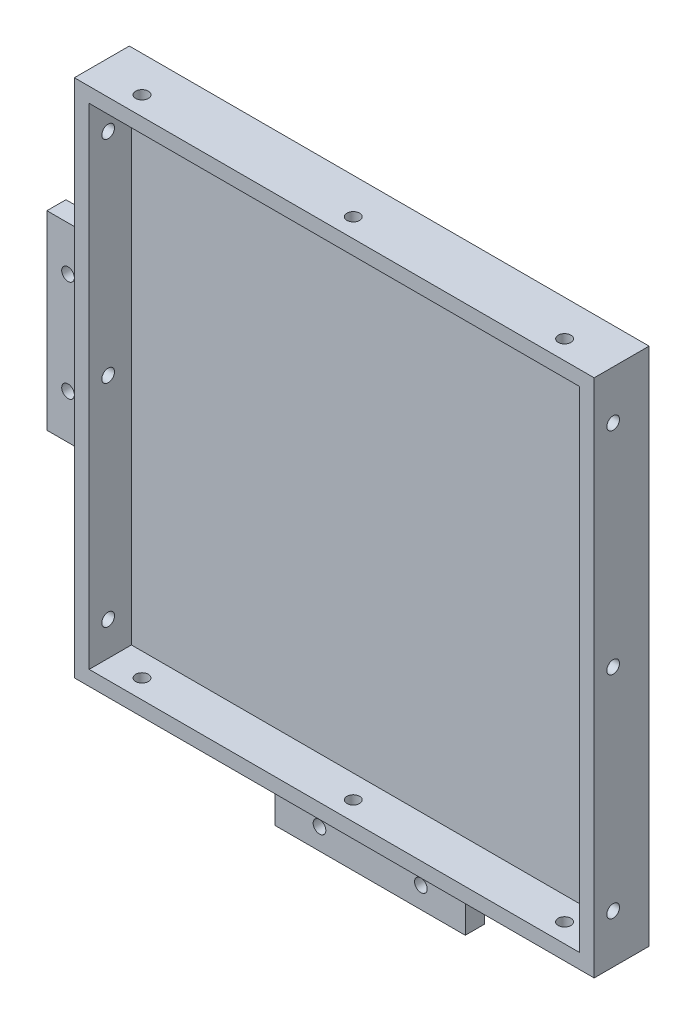
from build123d import *

# Parameters (mm, degrees)
SKETCH_3_W               = 123
SKETCH_3_H               = 123
EXTRUDE_2_DEPTH          = 3
SKETCH_4_W               = 123
SKETCH_4_H               = 123
SKETCH_4_W_2             = 116
SKETCH_4_H_2             = 116
EXTRUDE_3_DEPTH          = 10
SKETCH_7_R               = 1.5
CUT_EXTRUDE_1_DEPTH      = 139.131278138
SKETCH_9_R               = 1.5
CUT_EXTRUDE_2_DEPTH      = 139.131278138
SKETCH_10_W              = 45
SKETCH_10_H              = 15
EXTRUDE_4_DEPTH          = 4.5
SKETCH_11_R              = 1.5
CUT_EXTRUDE_3_DEPTH      = 99.522839992
PATTERN_CIRCULAR_1_COUNT = 2
PATTERN_CIRCULAR_1_ANGLE = 90
FILLET_1_R               = 8
SKETCH_13_R              = 3
CUT_EXTRUDE_4_DEPTH      = 146.431255238
SKETCH_14_R              = 2.049164466
CUT_EXTRUDE_6_DEPTH      = 146.431255238


with BuildPart() as part:
    # 草图3 → 凸台-拉伸2 (new body)
    with BuildSketch(Plane.XY):
        Rectangle(SKETCH_3_W, SKETCH_3_H)
    extrude(amount=EXTRUDE_2_DEPTH)

    # 草图4 → 凸台-拉伸3 (add)
    with BuildSketch(Plane.XY.offset(3)):
        Rectangle(SKETCH_4_W, SKETCH_4_H)
        Rectangle(SKETCH_4_W_2, SKETCH_4_H_2, mode=Mode.SUBTRACT)
    extrude(amount=EXTRUDE_3_DEPTH)

    # 草图7 → 切除-拉伸1 (cut, through all)
    with BuildSketch(Plane.XZ.offset(61.5)):
        with Locations((0, 8.5)):
            Circle(SKETCH_7_R)
        with Locations((50, 8.5)):
            Circle(SKETCH_7_R)
        with Locations((-50, 8.5)):
            Circle(SKETCH_7_R)
    extrude(amount=-CUT_EXTRUDE_1_DEPTH, mode=Mode.SUBTRACT)

    # 草图9 → 切除-拉伸2 (cut, through all)
    with BuildSketch(Plane.ZY.offset(61.5)):
        with Locations((8.5, 0)):
            Circle(SKETCH_9_R)
        with Locations((8.5, -50)):
            Circle(SKETCH_9_R)
        with Locations((8.5, 50)):
            Circle(SKETCH_9_R)
    extrude(amount=-CUT_EXTRUDE_2_DEPTH, mode=Mode.SUBTRACT)

    # 草图10 → 凸台-拉伸4 (add)
    with BuildSketch(Plane(origin=(0, 0, 0), x_dir=(-1, 0, 0), z_dir=(0, 0, -1))):
        with Locations((0, -69)):
            Rectangle(SKETCH_10_W, SKETCH_10_H)
    extrude_4 = extrude(amount=-EXTRUDE_4_DEPTH)

    # 草图11 → 切除-拉伸3 (cut, through all)
    with BuildSketch(Plane.XY.offset(4.5)):
        with Locations((-12, -71.5)):
            Circle(SKETCH_11_R)
        with Locations((12, -71.5)):
            Circle(SKETCH_11_R)
    cut_extrude_3 = extrude(amount=-CUT_EXTRUDE_3_DEPTH, mode=Mode.SUBTRACT)

    # 阵列(圆周)1: 凸台-拉伸4, 切除-拉伸3 ×2 about axis
    pattern_circular_1_axis = Axis((0, 0, 0), (0, 0, -1))
    add([extrude_4.rotate(pattern_circular_1_axis, i * PATTERN_CIRCULAR_1_ANGLE / (PATTERN_CIRCULAR_1_COUNT - 1)) for i in range(1, PATTERN_CIRCULAR_1_COUNT)])
    add([cut_extrude_3.rotate(pattern_circular_1_axis, i * PATTERN_CIRCULAR_1_ANGLE / (PATTERN_CIRCULAR_1_COUNT - 1)) for i in range(1, PATTERN_CIRCULAR_1_COUNT)], mode=Mode.SUBTRACT)

    # 圆角1
    # the kernel refuses this fillet: 8 mm, written as the material it adds along each edge
    with BuildSketch(Plane(origin=(-61.5, 22.5, 0), x_dir=(0, 1, 0), z_dir=(0, 0, 1)), Plane(origin=(-22.5, -61.5, 0), x_dir=(-1, 0, 0), z_dir=(0, 0, 1))) as fillet_1_piece_1:
        with BuildLine():
            CenterArc((FILLET_1_R, FILLET_1_R), FILLET_1_R, 180, 90)
            Line((0, FILLET_1_R), (0, 0))
            Line((0, 0), (FILLET_1_R, 0))
        make_face()
    extrude(amount=4.5)
    with BuildSketch(Plane(origin=(-61.5, -22.5, 4.5), x_dir=(0, 0, 1), z_dir=(0, 1, 0))) as fillet_1_piece_2_section:
        with BuildLine():
            CenterArc((FILLET_1_R, -FILLET_1_R), FILLET_1_R, 90, 90)
            Line((0, -FILLET_1_R), (0, 0))
            Line((0, 0), (FILLET_1_R, 0))
        make_face()
    fillet_1_piece_2 = extrude(amount=45, mode=Mode.PRIVATE)
    fillet_1_piece_2 = fillet_1_piece_2 - Plane(origin=(-63.326853287, 0, 8.5), x_dir=(0, 0, 1), z_dir=(-1, 0, 0)) * Cylinder(1.5, 122, mode=Mode.PRIVATE)
    add(fillet_1_piece_2)
    with BuildSketch(Plane(origin=(-61.5, -22.5, 0), x_dir=(0, -1, 0), z_dir=(0, 0, 1)), Plane(origin=(22.5, -61.5, 0), x_dir=(1, 0, 0), z_dir=(0, 0, 1))) as fillet_1_piece_3:
        with BuildLine():
            CenterArc((FILLET_1_R, -FILLET_1_R), FILLET_1_R, 90, 90)
            Line((0, -FILLET_1_R), (0, 0))
            Line((0, 0), (FILLET_1_R, 0))
        make_face()
    extrude(amount=4.5)
    with BuildSketch(Plane(origin=(22.5, -61.5, 4.5), x_dir=(0, 0, 1), z_dir=(-1, 0, 0))) as fillet_1_piece_4_section:
        with BuildLine():
            CenterArc((FILLET_1_R, -FILLET_1_R), FILLET_1_R, 90, 90)
            Line((0, -FILLET_1_R), (0, 0))
            Line((0, 0), (FILLET_1_R, 0))
        make_face()
    fillet_1_piece_4 = extrude(amount=45, mode=Mode.PRIVATE)
    fillet_1_piece_4 = fillet_1_piece_4 - Plane(origin=(0, -63.326852549, 8.5), x_dir=(1, 0, 0), z_dir=(0, -1, 0)) * Cylinder(1.5, 122, mode=Mode.PRIVATE)
    add(fillet_1_piece_4)
    with BuildSketch(Plane(origin=(-61.5, -22.5, 4.5), x_dir=(0, 0, 1), z_dir=(0, 1, 0))) as fillet_1_piece_5a_section:
        with BuildLine():
            CenterArc((FILLET_1_R, -FILLET_1_R), FILLET_1_R, 90, 90)
            Line((0, -FILLET_1_R), (0, 0))
            Line((0, 0), (FILLET_1_R, 0))
        make_face()
    fillet_1_piece_5a = extrude(amount=65, mode=Mode.PRIVATE)
    fillet_1_piece_5a = split(fillet_1_piece_5a, bisect_by=Plane(origin=(-63.311160914, 22.5, 6.311160914), z_dir=(0, 1, 0)), keep=Keep.TOP, mode=Mode.PRIVATE)
    with BuildSketch(Plane(origin=(-61.5, 22.5, 0), x_dir=(0, 1, 0), z_dir=(0, 0, 1))) as fillet_1_piece_5b_section:
        with BuildLine():
            CenterArc((FILLET_1_R, FILLET_1_R), FILLET_1_R, 180, 90)
            Line((0, FILLET_1_R), (0, 0))
            Line((0, 0), (FILLET_1_R, 0))
        make_face()
    fillet_1_piece_5b = extrude(amount=24.5, mode=Mode.PRIVATE)
    fillet_1_piece_5b = split(fillet_1_piece_5b, bisect_by=Plane(origin=(-63.311160914, 24.311160914, 13), z_dir=(0, 0, -1)), keep=Keep.TOP, mode=Mode.PRIVATE)
    fillet_1_piece_5b = split(fillet_1_piece_5b, bisect_by=Plane(origin=(-63.311160914, 24.311160914, 4.5), z_dir=(0, 0, 1)), keep=Keep.TOP, mode=Mode.PRIVATE)
    fillet_1_piece_5 = fillet_1_piece_5a & fillet_1_piece_5b
    add(fillet_1_piece_5)
    with BuildSketch(Plane(origin=(-61.5, -22.5, 0), x_dir=(0, -1, 0), z_dir=(0, 0, 1))) as fillet_1_piece_6a_section:
        with BuildLine():
            CenterArc((FILLET_1_R, -FILLET_1_R), FILLET_1_R, 90, 90)
            Line((0, -FILLET_1_R), (0, 0))
            Line((0, 0), (FILLET_1_R, 0))
        make_face()
    fillet_1_piece_6a = extrude(amount=24.5, mode=Mode.PRIVATE)
    fillet_1_piece_6a = split(fillet_1_piece_6a, bisect_by=Plane(origin=(-63.311160914, -24.311160914, 13), z_dir=(0, 0, -1)), keep=Keep.TOP, mode=Mode.PRIVATE)
    fillet_1_piece_6a = split(fillet_1_piece_6a, bisect_by=Plane(origin=(-63.311160914, -24.311160914, 4.5), z_dir=(0, 0, 1)), keep=Keep.TOP, mode=Mode.PRIVATE)
    with BuildSketch(Plane(origin=(-61.5, -42.5, 4.5), x_dir=(0, 0, 1), z_dir=(0, 1, 0))) as fillet_1_piece_6b_section:
        with BuildLine():
            CenterArc((FILLET_1_R, -FILLET_1_R), FILLET_1_R, 90, 90)
            Line((0, -FILLET_1_R), (0, 0))
            Line((0, 0), (FILLET_1_R, 0))
        make_face()
    fillet_1_piece_6b = extrude(amount=65, mode=Mode.PRIVATE)
    fillet_1_piece_6b = split(fillet_1_piece_6b, bisect_by=Plane(origin=(-63.311160914, -22.5, 6.311160914), z_dir=(0, -1, 0)), keep=Keep.TOP, mode=Mode.PRIVATE)
    fillet_1_piece_6 = fillet_1_piece_6a & fillet_1_piece_6b
    add(fillet_1_piece_6)
    with BuildSketch(Plane(origin=(22.5, -61.5, 4.5), x_dir=(0, 0, 1), z_dir=(-1, 0, 0))) as fillet_1_piece_7a_section:
        with BuildLine():
            CenterArc((FILLET_1_R, -FILLET_1_R), FILLET_1_R, 90, 90)
            Line((0, -FILLET_1_R), (0, 0))
            Line((0, 0), (FILLET_1_R, 0))
        make_face()
    fillet_1_piece_7a = extrude(amount=65, mode=Mode.PRIVATE)
    fillet_1_piece_7a = split(fillet_1_piece_7a, bisect_by=Plane(origin=(-22.5, -63.311160914, 6.311160914), z_dir=(-1, 0, 0)), keep=Keep.TOP, mode=Mode.PRIVATE)
    with BuildSketch(Plane(origin=(-22.5, -61.5, 0), x_dir=(-1, 0, 0), z_dir=(0, 0, 1))) as fillet_1_piece_7b_section:
        with BuildLine():
            CenterArc((FILLET_1_R, FILLET_1_R), FILLET_1_R, 180, 90)
            Line((0, FILLET_1_R), (0, 0))
            Line((0, 0), (FILLET_1_R, 0))
        make_face()
    fillet_1_piece_7b = extrude(amount=24.5, mode=Mode.PRIVATE)
    fillet_1_piece_7b = split(fillet_1_piece_7b, bisect_by=Plane(origin=(-24.311160914, -63.311160914, 13), z_dir=(0, 0, -1)), keep=Keep.TOP, mode=Mode.PRIVATE)
    fillet_1_piece_7b = split(fillet_1_piece_7b, bisect_by=Plane(origin=(-24.311160914, -63.311160914, 4.5), z_dir=(0, 0, 1)), keep=Keep.TOP, mode=Mode.PRIVATE)
    fillet_1_piece_7 = fillet_1_piece_7a & fillet_1_piece_7b
    add(fillet_1_piece_7)
    with BuildSketch(Plane(origin=(22.5, -61.5, 0), x_dir=(1, 0, 0), z_dir=(0, 0, 1))) as fillet_1_piece_8a_section:
        with BuildLine():
            CenterArc((FILLET_1_R, -FILLET_1_R), FILLET_1_R, 90, 90)
            Line((0, -FILLET_1_R), (0, 0))
            Line((0, 0), (FILLET_1_R, 0))
        make_face()
    fillet_1_piece_8a = extrude(amount=24.5, mode=Mode.PRIVATE)
    fillet_1_piece_8a = split(fillet_1_piece_8a, bisect_by=Plane(origin=(24.311160914, -63.311160914, 13), z_dir=(0, 0, -1)), keep=Keep.TOP, mode=Mode.PRIVATE)
    fillet_1_piece_8a = split(fillet_1_piece_8a, bisect_by=Plane(origin=(24.311160914, -63.311160914, 4.5), z_dir=(0, 0, 1)), keep=Keep.TOP, mode=Mode.PRIVATE)
    with BuildSketch(Plane(origin=(42.5, -61.5, 4.5), x_dir=(0, 0, 1), z_dir=(-1, 0, 0))) as fillet_1_piece_8b_section:
        with BuildLine():
            CenterArc((FILLET_1_R, -FILLET_1_R), FILLET_1_R, 90, 90)
            Line((0, -FILLET_1_R), (0, 0))
            Line((0, 0), (FILLET_1_R, 0))
        make_face()
    fillet_1_piece_8b = extrude(amount=65, mode=Mode.PRIVATE)
    fillet_1_piece_8b = split(fillet_1_piece_8b, bisect_by=Plane(origin=(22.5, -63.311160914, 6.311160914), z_dir=(1, 0, 0)), keep=Keep.TOP, mode=Mode.PRIVATE)
    fillet_1_piece_8 = fillet_1_piece_8a & fillet_1_piece_8b
    add(fillet_1_piece_8)

    # 草图13 → 切除-拉伸4 (cut, through all)
    with BuildSketch(Plane.ZY.offset(61.5)):
        with Locations(Location((8.5, 0, 0), (0, 0, 180))):
            Circle(SKETCH_13_R)
    extrude(amount=CUT_EXTRUDE_4_DEPTH, mode=Mode.SUBTRACT)

    # 草图14 → 切除-拉伸6 (cut, through all)
    with BuildSketch(Plane.XZ.offset(61.5)):
        with Locations(Location((0, 8.5, 0), (0, 0, 180))):
            Circle(SKETCH_14_R)
    extrude(amount=CUT_EXTRUDE_6_DEPTH, mode=Mode.SUBTRACT)


solid = part.part
